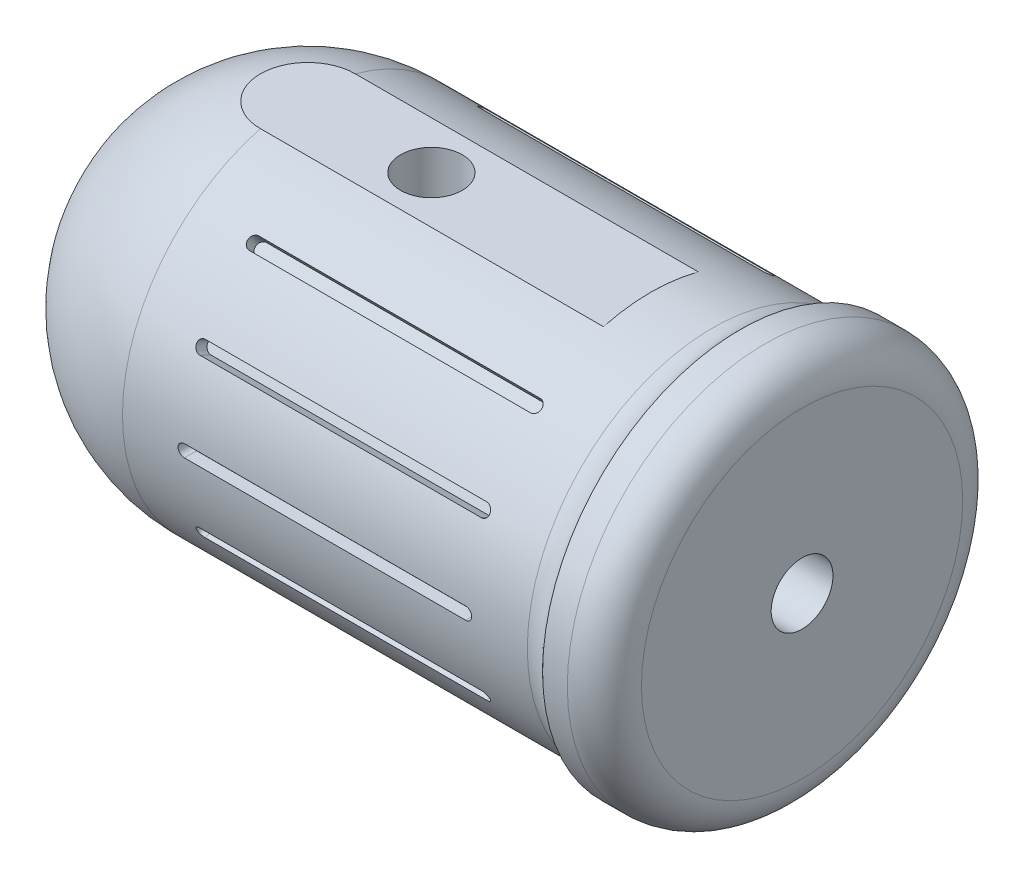
from build123d import *
from OCP.BRepFilletAPI import BRepFilletAPI_MakeFillet

# Parameters (mm, degrees)
FILLET1_R          = 3
SKETCH2_R          = 2.5
CUT_EXTRUDE1_DEPTH = 5
CUT_EXTRUDE2_START = 15
SKETCH3_R          = 2.5
CUT_EXTRUDE2_DEPTH = 5
CUT_EXTRUDE3_START = 15
CUT_EXTRUDE3_DEPTH = 1
CIRPATTERN1_COUNT  = 14
SKETCH5_W          = 40
SKETCH5_H          = 5
CUT_EXTRUDE4_DEPTH = 46.956501207
CUT_EXTRUDE5_START = -15
SKETCH6_R          = 5
SKETCH6_R_2        = 3
CUT_EXTRUDE5_DEPTH = 10
FILLET2_R1         = 1
FILLET2_R2         = 2


with BuildPart() as part:
    # Sketch1 → Revolve1 (revolve)
    with BuildSketch(Plane.XY, mode=Mode.PRIVATE) as revolve1_sk:
        with BuildLine():
            Line((0, 15), (35, 15))
            Line((35, 15), (35, 16))
            Line((35, 16), (40, 16))
            Line((40, 16), (40, 0))
            Line((40, 0), (-15, 0))
            ThreePointArc((-15, 0), (-10.606601718, 10.606601718), (0, 15))
        make_face()
    revolve(revolve1_sk.sketch.rotate(Axis((-15, 0, 0), (1, 0, 0)), 90), axis=Axis((-15, 0, 0), (1, 0, 0)))

    # Fillet1
    # the kernel refuses this fillet: 3 mm, written as the material it adds along each edge
    with BuildSketch(Plane(origin=(35, 0, 0), x_dir=(0, 0, 1), z_dir=(0, 1, 0))) as fillet1_piece_1:
        with BuildLine():
            CenterArc((18, -2.236067977), FILLET1_R, 131.810314896, 48.189685104)
            Line((16, 0), (15, 0))
            Line((15, 0), (15, -2.236067977))
        make_face()
    revolve(axis=Axis((35, 0, 0), (1, 0, 0)))
    # the kernel refuses this fillet: 3 mm, written as the material it takes off along each edge
    with BuildSketch(Plane(origin=(40, 0, 0), x_dir=(0, 0, 1), z_dir=(0, 1, 0))) as fillet1_2_piece_1:
        with BuildLine():
            CenterArc((16 - FILLET1_R, -FILLET1_R), FILLET1_R, 0, 90)
            Line((16 - FILLET1_R, 0), (16, 0))
            Line((16, 0), (16, -FILLET1_R))
        make_face()
    revolve(axis=Axis((40, 0, 0), (1, 0, 0)), mode=Mode.SUBTRACT)

    # Sketch2 → Cut-Extrude1 (cut)
    with BuildSketch(Plane(origin=(40, 0, 0), x_dir=(0, 0, -1), z_dir=(1, 0, 0))):
        Circle(SKETCH2_R)
    extrude(amount=-CUT_EXTRUDE1_DEPTH, mode=Mode.SUBTRACT)

    # Sketch3 → Cut-Extrude2 (cut)
    with BuildSketch(Plane(origin=(0, 0, 0), x_dir=(1, 0, 0), z_dir=(0, 1, 0)).offset(CUT_EXTRUDE2_START)):
        with Locations(Location((10, 0, 0), (0, 0, 270))):
            Circle(SKETCH3_R)
    cut_extrude2 = extrude(amount=-CUT_EXTRUDE2_DEPTH, mode=Mode.SUBTRACT)

    # Mirror1: Cut-Extrude2 across plane
    add(cut_extrude2.mirror(Plane.ZX), mode=Mode.SUBTRACT)

    # Sketch4 → Cut-Extrude3 (cut)
    with BuildSketch(Plane.XY.offset(CUT_EXTRUDE3_START)):
        with BuildLine():
            Line((5, 0.5), (27.763932023, 0.5))
            ThreePointArc((27.763932023, 0.5), (28.263932023, 0), (27.763932023, -0.5))
            Line((27.763932023, -0.5), (5, -0.5))
            ThreePointArc((5, -0.5), (4.5, 0), (5, 0.5))
        make_face()
    cut_extrude3 = extrude(amount=-CUT_EXTRUDE3_DEPTH, mode=Mode.SUBTRACT)

    # CirPattern1: Cut-Extrude3 ×14 about axis, 4 skipped
    cirpattern1_axis = Axis((0, 0, 0), (1, 0, 0))
    add([cut_extrude3.rotate(cirpattern1_axis, i * 360 / CIRPATTERN1_COUNT) for i in range(1, CIRPATTERN1_COUNT) if i not in (3, 4, 10, 11)], mode=Mode.SUBTRACT)

    # Sketch5 → Cut-Extrude4 (cut, symmetric)
    with BuildSketch(Plane.XY):
        with Locations((7.763932023, 17)):
            Rectangle(SKETCH5_W, SKETCH5_H)
    cut_extrude4 = extrude(amount=CUT_EXTRUDE4_DEPTH, both=True, mode=Mode.SUBTRACT)

    # Mirror2: Cut-Extrude4 across plane
    add(cut_extrude4.mirror(Plane.ZX), mode=Mode.SUBTRACT)

    # Sketch6 → Cut-Extrude5 (cut)
    with BuildSketch(Plane(origin=(0, 0, 0), x_dir=(0, 0, -1), z_dir=(1, 0, 0)).offset(CUT_EXTRUDE5_START)):
        Circle(SKETCH6_R)
        Circle(SKETCH6_R_2, mode=Mode.SUBTRACT)
    extrude(amount=CUT_EXTRUDE5_DEPTH, mode=Mode.SUBTRACT)

    # Fillet2: one fillet with a radius per group of edges: ONE call of the kernel's fillet builder (fillet() takes one radius for all edges)
    fillet2_edges_1 = [part.edges().sort_by_distance(p)[0] for p in [
        (-14.696938457, 3, 0),
    ]]
    fillet2_edges_2 = [part.edges().sort_by_distance(p)[0] for p in [
        (-14.142135624, 5, 0),
    ]]
    fillet2 = BRepFilletAPI_MakeFillet(part.part.solid().wrapped)
    for e in fillet2_edges_1:
        fillet2.Add(FILLET2_R1, e.wrapped)
    for e in fillet2_edges_2:
        fillet2.Add(FILLET2_R2, e.wrapped)
    add(Compound.cast(fillet2.Shape()), mode=Mode.REPLACE)


solid = part.part
